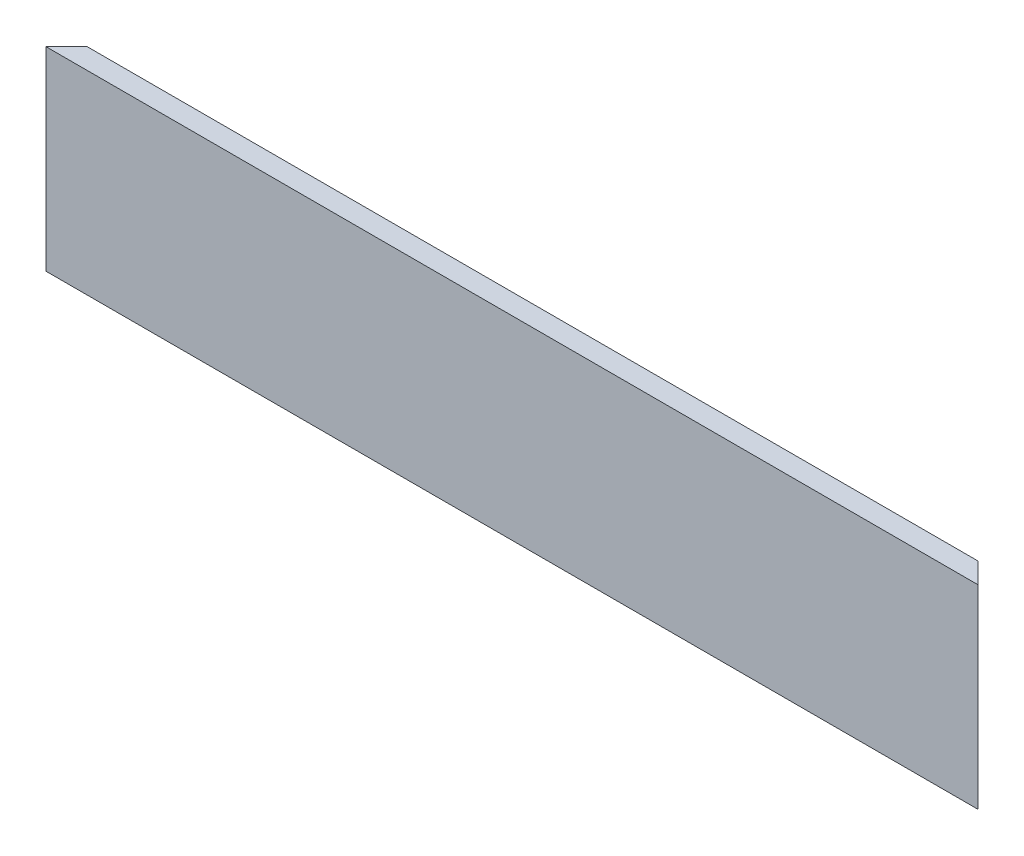
from build123d import *

# Parameters (mm, degrees)
SKETCH1_W           = 575
SKETCH1_H           = 120
BOSS_EXTRUDE1_DEPTH = 12.7
CHAMFER1_SIZE       = 12.7


with BuildPart() as part:
    # Sketch1 → Boss-Extrude1 (new body)
    with BuildSketch(Plane.XY):
        Rectangle(SKETCH1_W, SKETCH1_H)
    extrude(amount=BOSS_EXTRUDE1_DEPTH)

    # Chamfer1
    chamfer1_edges = [part.edges().sort_by_distance(p)[0] for p in [
        (287.5, 0, 0),
        (0, -60, 0),
        (-287.5, 0, 0),
    ]]
    chamfer(chamfer1_edges, length=CHAMFER1_SIZE - 0.0001)  # a hair under: the kernel refuses the full size


solid = part.part
